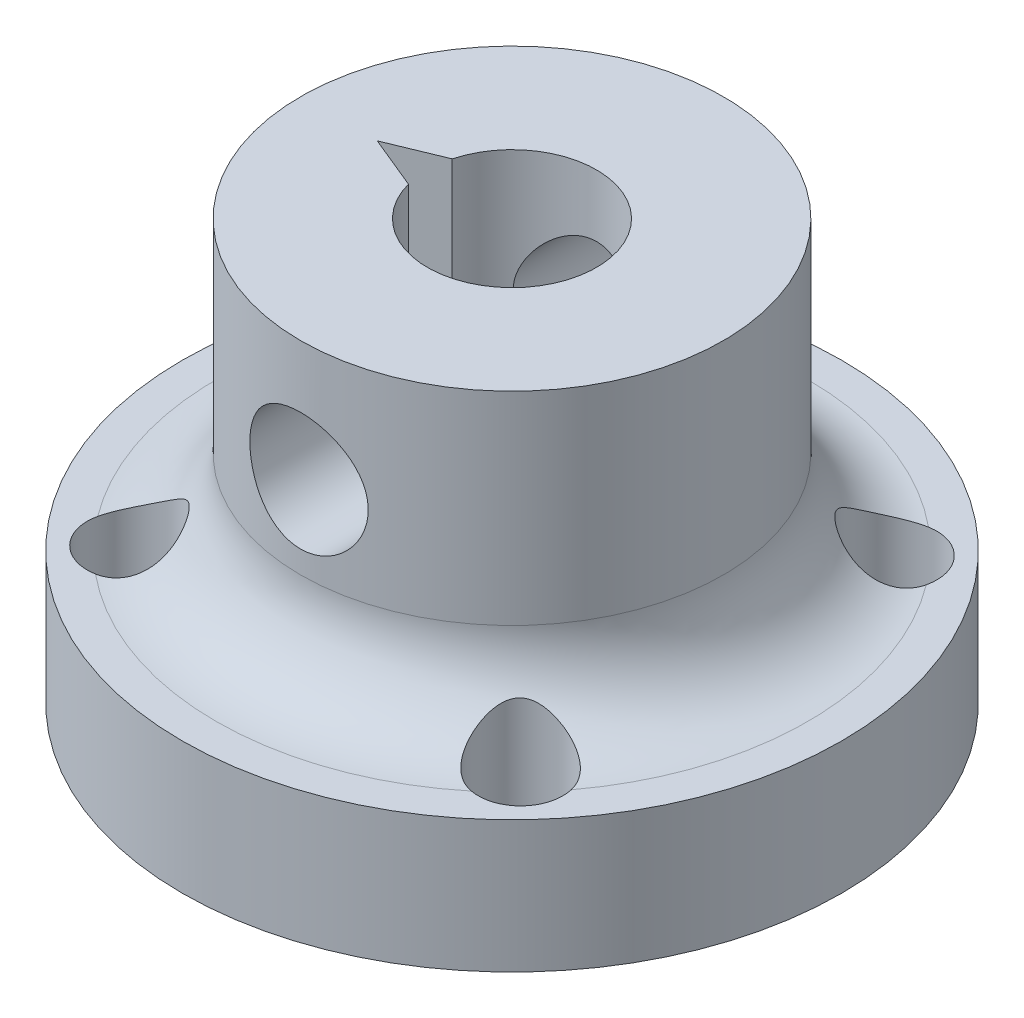
from build123d import *

# Parameters (mm, degrees)
SKETCH1_R               = 9.75
SKETCH1_R_2             = 1.25
BOSS_EXTRUDE2_DEPTH     = 2
SKETCH2_R               = 6.25
BOSS_EXTRUDE3_DEPTH     = 8.5
SKETCH4_R               = 2.5
CUT_EXTRUDE1_DEPTH      = 7.5
CUT_EXTRUDE2_DEPTH      = 7.5
CUT_EXTRUDE2_DEPTH_BACK = 6.75
SKETCH5_R               = 1.75
BOSS_EXTRUDE5_START     = 1.9
SKETCH7_R               = 9.75
SKETCH7_R_2             = 4.5
SKETCH7_R_3             = 1.25
BOSS_EXTRUDE5_DEPTH     = 1.9
CUT_EXTRUDE3_DEPTH      = 8
FILLET1_R               = 2.5


with BuildPart() as part:
    # Sketch1 → Boss-Extrude2 (new body)
    with BuildSketch(Plane(origin=(0, 0, 0), x_dir=(1, 0, 0), z_dir=(0, 1, 0))):
        with Locations(Location((0, 0, 0), (0, 0, 270))):
            Circle(SKETCH1_R)
        with Locations(Location((-5.78230038, 5.52856241, 0), (0, 0, 270))):
            Circle(SKETCH1_R_2, mode=Mode.SUBTRACT)
        with Locations(Location((-5.78230038, -5.52856241, 0), (0, 0, 270))):
            Circle(SKETCH1_R_2, mode=Mode.SUBTRACT)
        with Locations(Location((5.78230038, -5.52856241, 0), (0, 0, 270))):
            Circle(SKETCH1_R_2, mode=Mode.SUBTRACT)
        with Locations(Location((5.78230038, 5.52856241, 0), (0, 0, 270))):
            Circle(SKETCH1_R_2, mode=Mode.SUBTRACT)
    extrude(amount=BOSS_EXTRUDE2_DEPTH)

    # Sketch2 → Boss-Extrude3 (add)
    with BuildSketch(Plane(origin=(0, 2, 0), x_dir=(1, 0, 0), z_dir=(0, 1, 0))):
        with Locations(Location((0, 0, 0), (0, 0, 270))):
            Circle(SKETCH2_R)
    extrude(amount=BOSS_EXTRUDE3_DEPTH)

    # Sketch4 → Cut-Extrude1 (cut)
    with BuildSketch(Plane(origin=(0, 10.5, 0), x_dir=(1, 0, 0), z_dir=(0, 1, 0))):
        with Locations(Location((0, 0, 0), (0, 0, 270))):
            Circle(SKETCH4_R)
    extrude(amount=-CUT_EXTRUDE1_DEPTH, mode=Mode.SUBTRACT)

    # Sketch5 → Cut-Extrude2 (cut, two sides: drawn at the far end of the back side and taken through both)
    with BuildSketch(Plane.XY.offset(-CUT_EXTRUDE2_DEPTH_BACK)):
        with Locations(Location((0, 6.914506731, 0), (0, 0, 180))):
            Circle(SKETCH5_R)
    extrude(amount=CUT_EXTRUDE2_DEPTH + CUT_EXTRUDE2_DEPTH_BACK, mode=Mode.SUBTRACT)

    # Sketch7 → Boss-Extrude5 (add)
    with BuildSketch(Plane.XZ.offset(BOSS_EXTRUDE5_START)):
        with Locations(Location((0, 0, 0), (0, 0, 270))):
            Circle(SKETCH7_R)
        with Locations(Location((0, 0, 0), (0, 0, 90))):
            Circle(SKETCH7_R_2, mode=Mode.SUBTRACT)
        with Locations(Location((-5.78230038, 5.52856241, 0), (0, 0, 270))):
            Circle(SKETCH7_R_3, mode=Mode.SUBTRACT)
        with Locations(Location((5.78230038, 5.52856241, 0), (0, 0, 270))):
            Circle(SKETCH7_R_3, mode=Mode.SUBTRACT)
        with Locations(Location((5.78230038, -5.52856241, 0), (0, 0, 270))):
            Circle(SKETCH7_R_3, mode=Mode.SUBTRACT)
        with Locations(Location((-5.78230038, -5.52856241, 0), (0, 0, 270))):
            Circle(SKETCH7_R_3, mode=Mode.SUBTRACT)
    extrude(amount=-BOSS_EXTRUDE5_DEPTH)

    # Sketch9 → Cut-Extrude3 (cut)
    with BuildSketch(Plane(origin=(0, 10.5, 0), x_dir=(1, 0, 0), z_dir=(0, 1, 0))):
        Polygon((-2.414753661, -0.64727487), (-2.414753661, 0.64727487), (-3.984419716, 0), align=None)
    extrude(amount=-CUT_EXTRUDE3_DEPTH, mode=Mode.SUBTRACT)

    # Fillet1
    # the kernel refuses this fillet: 2.5 mm, written as the material it adds along each edge
    with BuildSketch(Plane(origin=(0, 2, 0), x_dir=(0, 0, 1), z_dir=(-1, 0, 0))) as fillet1_piece_1_section:
        with BuildLine():
            CenterArc((6.25 + FILLET1_R, FILLET1_R), FILLET1_R, 180, 90)
            Line((6.25, FILLET1_R), (6.25, 0))
            Line((6.25, 0), (6.25 + FILLET1_R, 0))
        make_face()
    fillet1_piece_1 = revolve(axis=Axis((0, 2, 0), (0, 1, 0)), mode=Mode.PRIVATE)
    fillet1_piece_1 = fillet1_piece_1 - Plane(origin=(-5.78230038, 2.704024644, 5.52856241), x_dir=(0, 0, 1), z_dir=(0, -1, 0)) * Cylinder(1.25, 35, mode=Mode.PRIVATE)
    fillet1_piece_1 = fillet1_piece_1 - Plane(origin=(5.78230038, 2.704024644, 5.52856241), x_dir=(0, 0, 1), z_dir=(0, -1, 0)) * Cylinder(1.25, 35, mode=Mode.PRIVATE)
    fillet1_piece_1 = fillet1_piece_1 - Plane(origin=(-5.78230038, 2.704024644, -5.52856241), x_dir=(0, 0, 1), z_dir=(0, -1, 0)) * Cylinder(1.25, 35, mode=Mode.PRIVATE)
    fillet1_piece_1 = fillet1_piece_1 - Plane(origin=(5.78230038, 2.704024644, -5.52856241), x_dir=(0, 0, 1), z_dir=(0, -1, 0)) * Cylinder(1.25, 35, mode=Mode.PRIVATE)
    add(fillet1_piece_1)


solid = part.part
